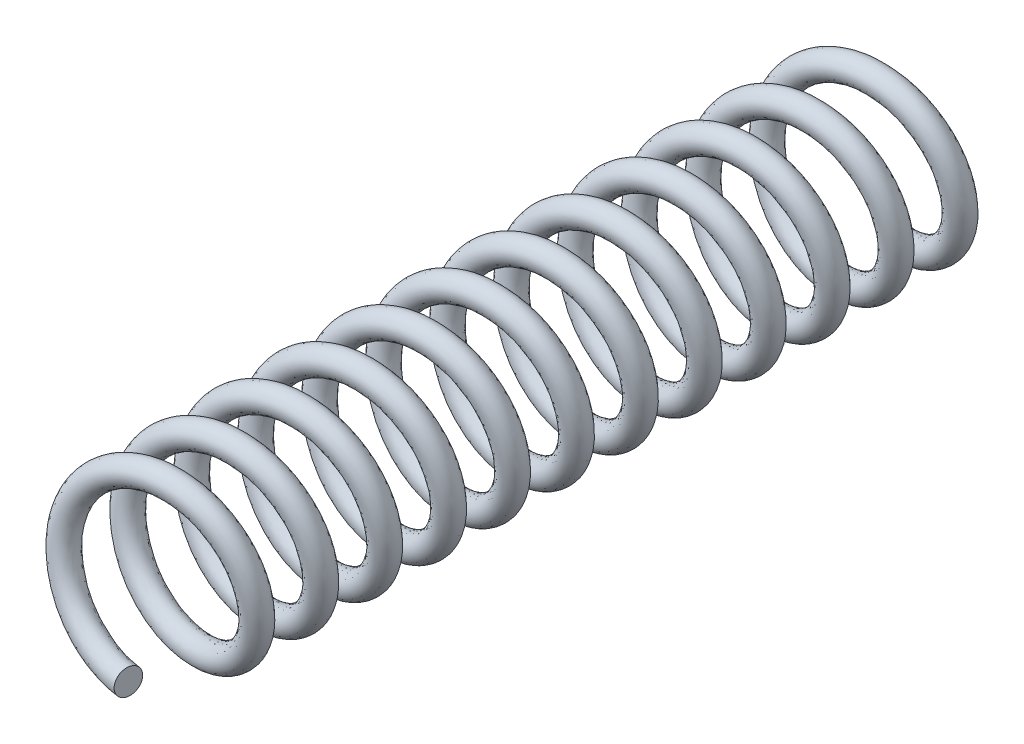
from build123d import *

# Parameters (mm, degrees)
SWEEP1_PITCH       = 2.54
SWEEP1_HEIGHT      = 30.48
SWEEP1_RADIUS      = 3.175
SWEEP1_START_ANGLE = -90
SWEEP1_PROFILE_R   = 0.508


with BuildPart() as part:
    # Sweep1: sweep along a helix
    with BuildLine() as sweep1_path:
        add(Helix(SWEEP1_PITCH, SWEEP1_HEIGHT, SWEEP1_RADIUS, center=(0, 0, 0), direction=(0, 0, 1), mode=Mode.PRIVATE).rotate(Axis((0, 0, 0), (0, 0, 1)), SWEEP1_START_ANGLE))
    # Sweep1 profile (on start of the path) → Sweep1 (sweep)
    with BuildSketch(Plane(origin=(0, -3.175, 0), x_dir=(-0.12630428643387628, 0, 0.9919915459460475), z_dir=(0.9919915459460475, -6.051911726471154e-13, 0.12630428643387628))):
        Circle(SWEEP1_PROFILE_R)
    sweep(path=sweep1_path.line, is_frenet=True)


solid = part.part
